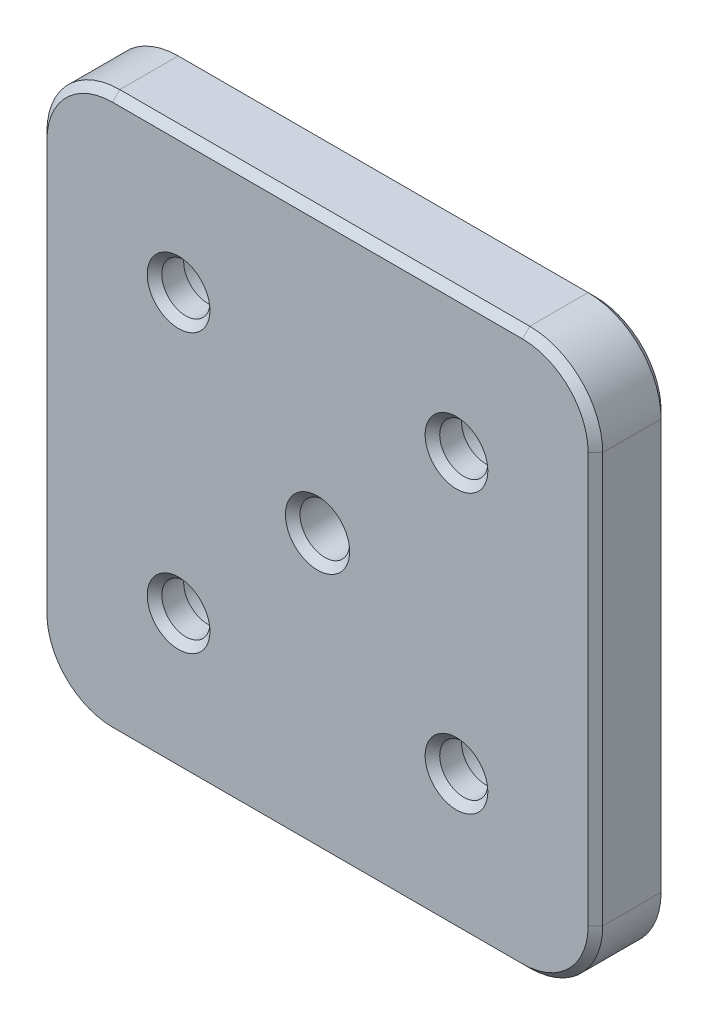
from build123d import *

# Parameters (mm, degrees)
SKETCH3_W                                     = 76.2
SKETCH3_H                                     = 76.2
BOSS_EXTRUDE3_DEPTH                           = 10
CBORE_FOR_M6_HEX_SOCKET_HEAD_CAP1_D           = 6.6
CBORE_FOR_M6_HEX_SOCKET_HEAD_CAP1_CBORE_D     = 11
CBORE_FOR_M6_HEX_SOCKET_HEAD_CAP1_CBORE_DEPTH = 6
FILLET1_R                                     = 10
SKETCH2_R                                     = 10
BOSS_EXTRUDE4_DEPTH                           = 10
SKETCH9_R                                     = 3.4
CUT_EXTRUDE1_DEPTH                            = 58.473646135
CHAMFER1_SIZE                                 = 1


with BuildPart() as part:
    # Sketch3 → Boss-Extrude3 (new body)
    with BuildSketch(Plane.XY):
        Rectangle(SKETCH3_W, SKETCH3_H)
    extrude(amount=BOSS_EXTRUDE3_DEPTH)

    # CBORE for M6 Hex Socket Head Cap1 (through all)
    with Locations(Plane(origin=(0, 0, 0), x_dir=(-1, 0, 0), z_dir=(0, 0, -1))):
        with Locations((19.05, 19.05), (19.05, -19.05), (-19.05, 19.05), (-19.05, -19.05)):
            CounterBoreHole(CBORE_FOR_M6_HEX_SOCKET_HEAD_CAP1_D / 2, CBORE_FOR_M6_HEX_SOCKET_HEAD_CAP1_CBORE_D / 2, CBORE_FOR_M6_HEX_SOCKET_HEAD_CAP1_CBORE_DEPTH)

    # Fillet1
    fillet1_edges = [part.edges().sort_by_distance(p)[0] for p in [
        (38.1, 38.1, 5),
        (38.1, -38.1, 5),
        (-38.1, -38.1, 5),
        (-38.1, 38.1, 5),
    ]]
    fillet(fillet1_edges, radius=FILLET1_R)

    # Sketch2 → Boss-Extrude4 (add)
    with BuildSketch(Plane(origin=(0, 0, 0), x_dir=(-1, 0, 0), z_dir=(0, 0, -1))):
        Circle(SKETCH2_R)
    extrude(amount=BOSS_EXTRUDE4_DEPTH)

    # Sketch9 → Cut-Extrude1 (cut, through all)
    with BuildSketch(Plane(origin=(0, 0, -10), x_dir=(-1, 0, 0), z_dir=(0, 0, -1))):
        Circle(SKETCH9_R)
    extrude(amount=-CUT_EXTRUDE1_DEPTH, mode=Mode.SUBTRACT)

    # Chamfer1
    chamfer1_edges = [part.edges().sort_by_distance(p)[0] for p in [
        (35.171067812, -35.171067812, 10),
        (0, -38.1, 10),
        (-35.171067812, -35.171067812, 10),
        (-38.1, 0, 10),
        (-35.171067812, 35.171067812, 10),
        (0, 38.1, 10),
        (35.171067812, 35.171067812, 10),
        (38.1, 0, 10),
        (15.75, -19.05, 10),
        (15.75, 19.05, 10),
        (-22.35, -19.05, 10),
        (-22.35, 19.05, 10),
        (3.4, 0, 10),
        (3.4, 0, -10),
        (10, 0, -10),
        (24.55, 19.05, 0),
        (24.55, -19.05, 0),
        (-13.55, -19.05, 0),
        (-13.55, 19.05, 0),
        (38.1, 0, 0),
        (35.171067812, 35.171067812, 0),
        (35.171067812, -35.171067812, 0),
        (0, 38.1, 0),
        (0, -38.1, 0),
        (-35.171067812, 35.171067812, 0),
        (-35.171067812, -35.171067812, 0),
        (-38.1, 0, 0),
    ]]
    chamfer(chamfer1_edges, length=CHAMFER1_SIZE)


solid = part.part
